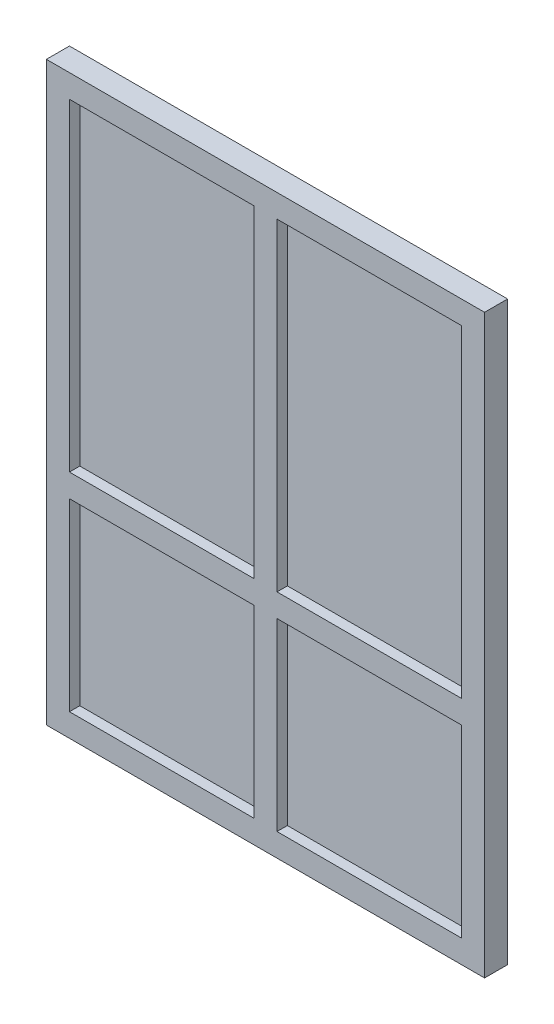
from build123d import *

# Parameters (mm, degrees)
SKETCH_1_W      = 1900
SKETCH_1_H      = 2500
SKETCH_1_W_2    = 800
SKETCH_1_H_2    = 1400
SKETCH_1_H_3    = 800
EXTRUDE_1_DEPTH = 50
SKETCH_2_W      = 1700
SKETCH_2_H      = 2300
EXTRUDE_2_DEPTH = 5


with BuildPart() as part:
    # Эскиз1 → Бобышка-Вытянуть1 (new, symmetric)
    with BuildSketch(Plane.XY):
        with Locations((50, 1250)):
            Rectangle(SKETCH_1_W, SKETCH_1_H)
        with Locations((-400, 1700)):
            Rectangle(SKETCH_1_W_2, SKETCH_1_H_2, mode=Mode.SUBTRACT)
        with Locations((-400, 500)):
            Rectangle(SKETCH_1_W_2, SKETCH_1_H_3, mode=Mode.SUBTRACT)
        with Locations((500, 1700)):
            Rectangle(SKETCH_1_W_2, SKETCH_1_H_2, mode=Mode.SUBTRACT)
        with Locations((500, 500)):
            Rectangle(SKETCH_1_W_2, SKETCH_1_H_3, mode=Mode.SUBTRACT)
    extrude(amount=EXTRUDE_1_DEPTH, both=True)


with BuildPart() as body_2:
    # Эскиз2 → Бобышка-Вытянуть2 (new, symmetric)
    with BuildSketch(Plane.XY):
        with Locations((50, 1250)):
            Rectangle(SKETCH_2_W, SKETCH_2_H)
    extrude(amount=EXTRUDE_2_DEPTH, both=True)


solid = Compound([part.part, body_2.part])
